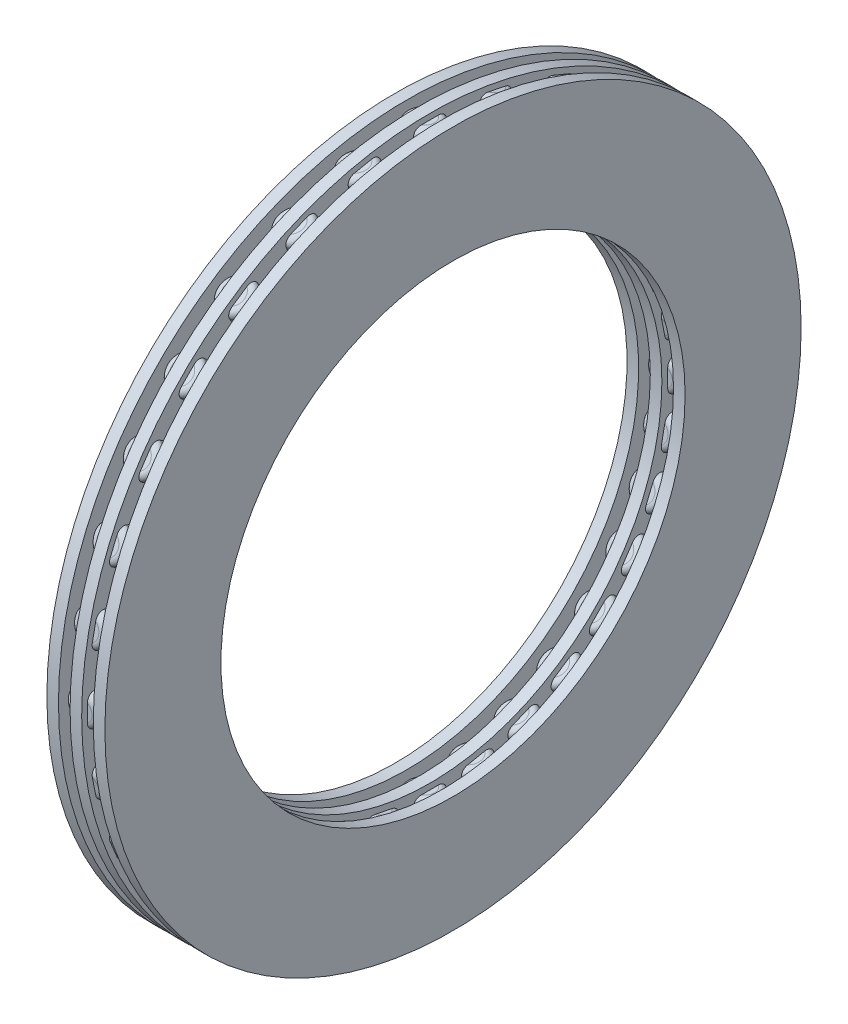
from build123d import *

# Parameters (mm, degrees)
CAGSPISKE_W           = 1
CAGSPISKE_H           = 10
ROLLERSDETAILED_COUNT = 32
ROLLERSDETAILED_ANGLE = 348.75
SKETCH1_R             = 30
SKETCH1_R_2           = 20
BOSS_EXTRUDE1_DEPTH   = 1
SKETCH2_R             = 30
SKETCH2_R_2           = 20
BOSS_EXTRUDE2_DEPTH   = 1


with BuildPart() as part:
    # CagSpiSke → CageSpine (revolve)
    with BuildSketch(Plane.XY):
        with Locations((0, 25)):
            Rectangle(CAGSPISKE_W, CAGSPISKE_H)
    revolve(axis=Axis((-34.925, 0, 0), (1, 0, 0)))

    # RolDetSke → RollerDetailed (revolve)
    with BuildSketch(Plane.XY):
        with BuildLine():
            Line((0, 29.5), (0.9, 29.5))
            ThreePointArc((0.9, 29.5), (1.324264069, 29.324264069), (1.5, 28.9))
            Line((1.5, 28.9), (1.5, 21.1))
            ThreePointArc((1.5, 21.1), (1.324264069, 20.675735931), (0.9, 20.5))
            Line((0.9, 20.5), (0, 20.5))
            Line((0, 20.5), (0, 29.5))
        make_face()
    rollerdetailed = revolve(axis=Axis((0, 33.02, 0), (0, 1, 0)))

    # RollersDetailed: RollerDetailed ×32 about axis
    rollersdetailed_axis = Axis((-50, 0, 0), (1, 0, 0))
    for i in range(1, ROLLERSDETAILED_COUNT):
        add(rollerdetailed.rotate(rollersdetailed_axis, i * ROLLERSDETAILED_ANGLE / (ROLLERSDETAILED_COUNT - 1)))


with BuildPart() as body_2:
    # Sketch1 → Boss-Extrude1 (new body)
    with BuildSketch(Plane(origin=(1.5, 0, 0), x_dir=(0, 0, -1), z_dir=(1, 0, 0))):
        Circle(SKETCH1_R)
        Circle(SKETCH1_R_2, mode=Mode.SUBTRACT)
    extrude(amount=BOSS_EXTRUDE1_DEPTH)


with BuildPart() as body_3:
    # Sketch2 → Boss-Extrude2 (new body)
    with BuildSketch(Plane.ZY.offset(1.5)):
        Circle(SKETCH2_R)
        Circle(SKETCH2_R_2, mode=Mode.SUBTRACT)
    extrude(amount=BOSS_EXTRUDE2_DEPTH)


solid = Compound([part.part, body_2.part, body_3.part])
